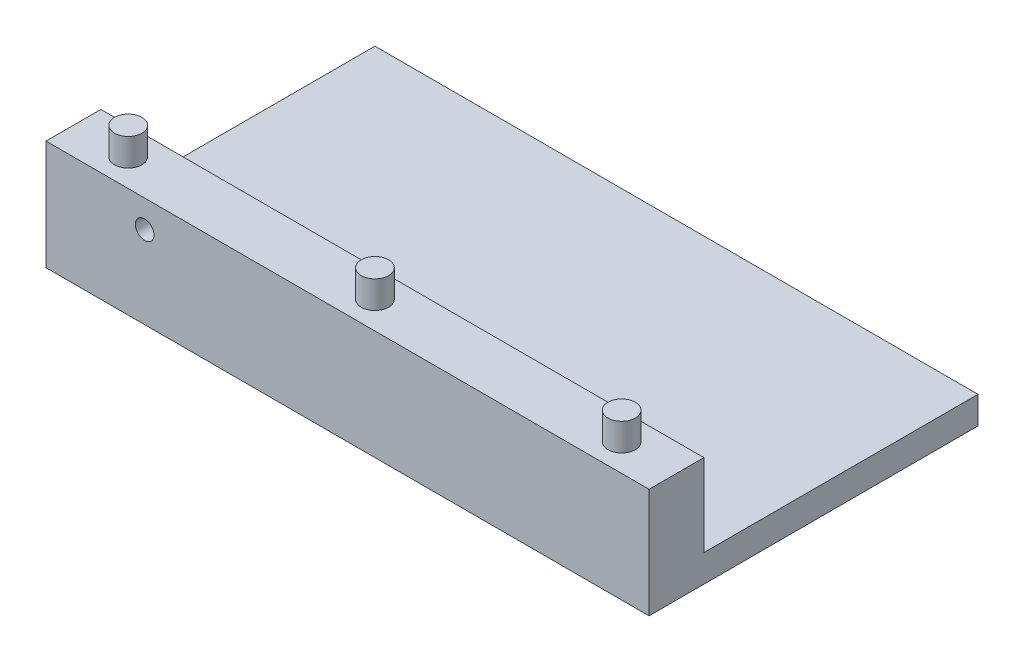
from build123d import *

# Parameters (mm, degrees)
SKETCH1_W           = 139.7
SKETCH1_H           = 76.2
BOSS_EXTRUDE1_DEPTH = 6.35
SKETCH2_W           = 139.7
SKETCH2_H           = 12.7
BOSS_EXTRUDE2_DEPTH = 19.05
SKETCH3_R           = 2.032
CUT_EXTRUDE1_DEPTH  = 82.814026915
CUT_EXTRUDE2_DEPTH  = 3.048
SKETCH5_R           = 3.175
BOSS_EXTRUDE3_DEPTH = 6.35
SKETCH6_R           = 2.159
CUT_EXTRUDE3_DEPTH  = 12.7


with BuildPart() as part:
    # Sketch1 → Boss-Extrude1 (new body)
    with BuildSketch(Plane(origin=(0, 0, 0), x_dir=(1, 0, 0), z_dir=(0, 1, 0))):
        Rectangle(SKETCH1_W, SKETCH1_H)
    extrude(amount=BOSS_EXTRUDE1_DEPTH)

    # Sketch2 → Boss-Extrude2 (add)
    with BuildSketch(Plane(origin=(0, 6.35, 0), x_dir=(1, 0, 0), z_dir=(0, 1, 0))):
        with Locations((0, -31.75)):
            Rectangle(SKETCH2_W, SKETCH2_H)
    extrude(amount=BOSS_EXTRUDE2_DEPTH)

    # Sketch3 → Cut-Extrude1 (cut, through all)
    with BuildSketch(Plane(origin=(0, 6.35, 0), x_dir=(1, 0, 0), z_dir=(0, 1, 0))):
        with Locations((-53.34, -21.59)):
            Circle(SKETCH3_R)
    extrude(amount=-CUT_EXTRUDE1_DEPTH, mode=Mode.SUBTRACT)

    # Sketch4 → Cut-Extrude2 (cut)
    with BuildSketch(Plane.XZ):
        Polygon((-50.927, 25.769438599), (-55.753, 25.769438599), (-58.166, 21.59), (-55.753, 17.410561401), (-50.927, 17.410561401), (-48.514, 21.59), align=None)
    extrude(amount=-CUT_EXTRUDE2_DEPTH, mode=Mode.SUBTRACT)

    # Sketch5 → Boss-Extrude3 (add)
    with BuildSketch(Plane(origin=(0, 25.4, 0), x_dir=(1, 0, 0), z_dir=(0, 1, 0))):
        with Locations((-57.15, -31.75)):
            Circle(SKETCH5_R)
        with Locations((0, -31.75)):
            Circle(SKETCH5_R)
        with Locations((57.15, -31.75)):
            Circle(SKETCH5_R)
    extrude(amount=BOSS_EXTRUDE3_DEPTH)

    # Sketch6 → Cut-Extrude3 (cut)
    with BuildSketch(Plane(origin=(0, 0, 25.4), x_dir=(-1, 0, 0), z_dir=(0, 0, -1))):
        with Locations((46.99, 19.05)):
            Circle(SKETCH6_R)
    extrude(amount=-CUT_EXTRUDE3_DEPTH, mode=Mode.SUBTRACT)


solid = part.part
